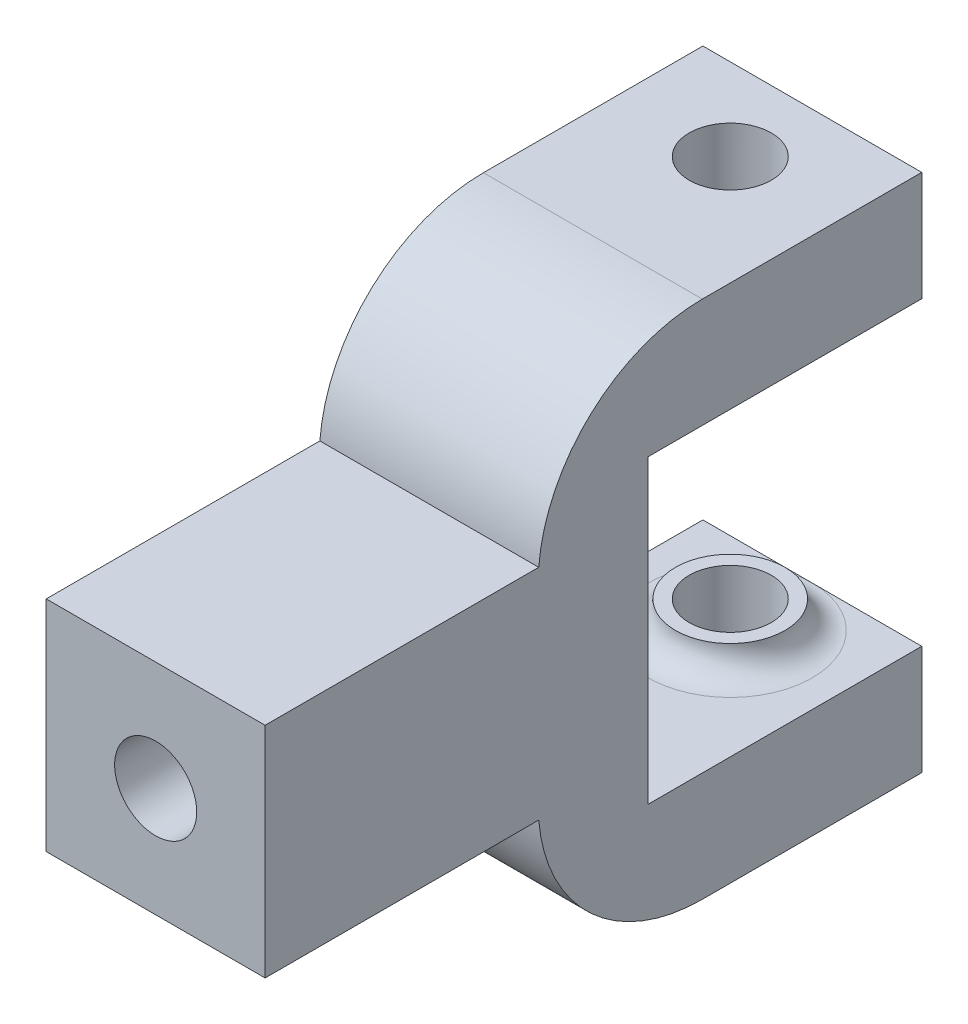
from build123d import *

# Parameters (mm, degrees)
EXTRUDE_1_DEPTH     = 8
CUT_EXTRUDE_1_REACH = 26.92
SKETCH_4_R          = 1.5
EXTRUDE_START       = 1
SKETCH_5_R          = 2
SKETCH_5_R_2        = 1.5
EXTRUDE_2_DEPTH     = 1
SKETCH_6_R          = 2
SKETCH_6_R_2        = 1.5
EXTRUDE_3_DEPTH     = 1
FILLET_1_R          = 1
FILLET_2_R          = 1
SKETCH_10_W         = 8
SKETCH_10_H         = 8
EXTRUDE_5_DEPTH     = 10
SKETCH_7_R          = 1.5
CUT_EXTRUDE_2_DEPTH = 14
CUT_EXTRUDE_3_DEPTH = 10
FILLET_3_R          = 6
FILLET_4_R          = 6


# Some blends are built 0.0001 mm under size
with BuildPart() as part:
    # Эскиз3 → Бобышка-Вытянуть1 (new body)
    with BuildSketch(Plane(origin=(0, 0, 0), x_dir=(0, 0, -1), z_dir=(1, 0, 0))):
        Polygon((0, 0), (14, 0), (14, 4), (4, 4), (4, 15), (14, 15), (14, 19), (0, 19), align=None)
    extrude(amount=EXTRUDE_1_DEPTH)

    # Вырез-Вытянуть1: up to this face of the body (flat: up to its plane)
    cut_extrude_1_end = Plane(part.part.faces().sort_by_distance((4, 0, -7))[0])
    # Эскиз4 → Вырез-Вытянуть1 (cut, up to the picked face)
    with BuildSketch(Plane(origin=(0, 19, 0), x_dir=(1, 0, 0), z_dir=(0, 1, 0)), mode=Mode.PRIVATE) as cut_extrude_1_sk1:
        with Locations(Location((4, 11, 0), (0, 0, 270))):
            Circle(SKETCH_4_R)
    cut_extrude_1_tool1 = split(extrude(cut_extrude_1_sk1.sketch, amount=-CUT_EXTRUDE_1_REACH, mode=Mode.PRIVATE), bisect_by=cut_extrude_1_end, keep=Keep.BOTH, mode=Mode.PRIVATE)
    add(cut_extrude_1_tool1.solids().sort_by(Axis((4, 19, -11), (0, -1, 0)))[0], mode=Mode.SUBTRACT)

    # Эскиз5 → Бобышка-Вытянуть2 (add)
    with BuildSketch(Plane(origin=(0, 4, 0), x_dir=(1, 0, 0), z_dir=(0, 1, 0)).offset(EXTRUDE_START)):
        with Locations(Location((4, 11, 0), (0, 0, 90))):
            Circle(SKETCH_5_R)
        with Locations(Location((4, 11, 0), (0, 0, 270))):
            Circle(SKETCH_5_R_2, mode=Mode.SUBTRACT)
    extrude(amount=-EXTRUDE_2_DEPTH)

    # Эскиз6 → Бобышка-Вытянуть3 (add)
    with BuildSketch(Plane(origin=(0, 15, 0), x_dir=(-1, 0, 0), z_dir=(0, -1, 0))):
        with Locations(Location((-4, 11, 0), (0, 0, 90))):
            Circle(SKETCH_6_R)
        with Locations(Location((-4, 11, 0), (0, 0, 270))):
            Circle(SKETCH_6_R_2, mode=Mode.SUBTRACT)
    extrude(amount=EXTRUDE_3_DEPTH)

    # Скругление1
    fillet_1_edges = [part.edges().sort_by_distance(p)[0] for p in [
        (4, 4, -9),
    ]]
    fillet(fillet_1_edges, radius=FILLET_1_R - 0.0001)  # a hair under: the kernel refuses the full size

    # Скругление2
    fillet_2_edges = [part.edges().sort_by_distance(p)[0] for p in [
        (4, 15, -9),
    ]]
    fillet(fillet_2_edges, radius=FILLET_2_R - 0.0001)  # a hair under: the kernel refuses the full size

    # Эскиз10 → Бобышка-Вытянуть5 (add)
    with BuildSketch(Plane.XY):
        with Locations((4, 9.5)):
            Rectangle(SKETCH_10_W, SKETCH_10_H)
    extrude(amount=EXTRUDE_5_DEPTH)

    # Эскиз7 → Вырез-Вытянуть2 (cut)
    with BuildSketch(Plane(origin=(0, 0, -4), x_dir=(-1, 0, 0), z_dir=(0, 0, -1))):
        with Locations((-4, 9.5)):
            Circle(SKETCH_7_R)
    extrude(amount=-CUT_EXTRUDE_2_DEPTH, mode=Mode.SUBTRACT)

    # Эскиз9 → Вырез-Вытянуть3 (cut)
    with BuildSketch(Plane(origin=(0, 0, -4), x_dir=(-1, 0, 0), z_dir=(0, 0, -1))):
        Polygon((-1.264118223, 11.111919426), (-4.028022284, 12.675302834), (-6.763904061, 11.063383407), (-6.735881777, 7.888080574), (-3.971977716, 6.324697166), (-1.236095939, 7.936616593), align=None)
    extrude(amount=-CUT_EXTRUDE_3_DEPTH, mode=Mode.SUBTRACT)

    # Скругление3
    # the kernel refuses this fillet: 6 mm, written as the material it takes off along each edge
    with BuildSketch(Plane(origin=(-14.947825929, 19, 0), x_dir=(0, 0, -1), z_dir=(1, 0, 0))) as fillet_3_piece_1:
        with BuildLine():
            CenterArc((5.979130372, -6), FILLET_3_R, 90, 85.219808153)
            Line((0, -5.5), (-0.119582607, -5.49))
            ThreePointArc((-0.119582607, -5.49), (-0.12, -2.75), (-0.12, 0))
            Line((-0.12, 0), (0, 0.12))
            Line((0, 0.12), (5.979130372, 0.12))
            Line((5.979130372, 0.12), (5.979130372, 0))
        make_face()
    extrude(amount=37.895651858, mode=Mode.SUBTRACT)

    # Скругление4
    # the kernel refuses this fillet: 6 mm, written as the material it takes off along each edge
    with BuildSketch(Plane(origin=(-14.947825929, 0, 0), x_dir=(0, 1, 0), z_dir=(1, 0, 0))) as fillet_4_piece_1:
        with BuildLine():
            CenterArc((6, -5.979130372), FILLET_4_R, 94.780191847, 85.219808153)
            Line((0, -5.979130372), (-0.12, -5.979130372))
            Line((-0.12, -5.979130372), (-0.12, 0))
            Line((-0.12, 0), (0, 0.12))
            ThreePointArc((0, 0.12), (2.75, 0.12), (5.49, 0.119582607))
            Line((5.49, 0.119582607), (5.5, 0))
        make_face()
    extrude(amount=37.895651858, mode=Mode.SUBTRACT)


solid = part.part
